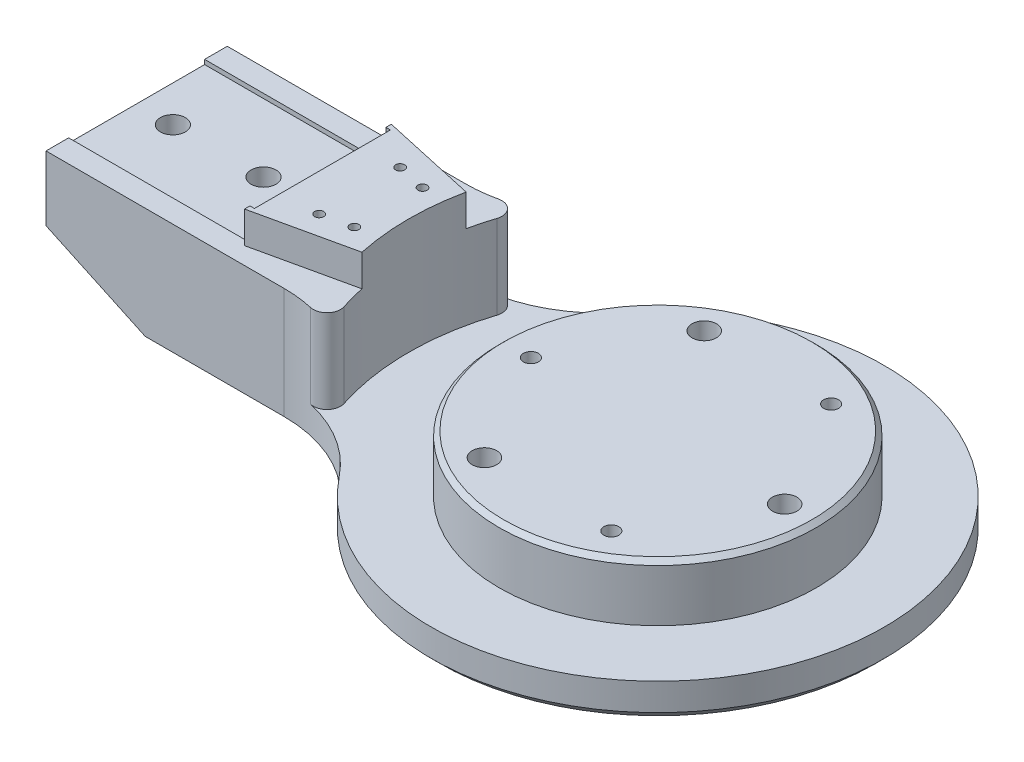
from build123d import *

# Parameters (mm, degrees)
SKETCH1_R           = 35.00000000000001
BOSS_EXTRUDE1_DEPTH = 1
SKETCH3_R           = 50
BOSS_EXTRUDE3_DEPTH = 8
BOSS_EXTRUDE5_START = -8
BOSS_EXTRUDE5_DEPTH = 8
BOSS_EXTRUDE6_DEPTH = 18.5
FILLET1_R           = 30
CUT_EXTRUDE14_DEPTH = 41
SKETCH26_R          = 2.750000000000008
CUT_EXTRUDE15_DEPTH = 129.1688339652039
CUT_EXTRUDE16_DEPTH = 12
BOSS_EXTRUDE7_DEPTH = 13
CUT_EXTRUDE21_DEPTH = 6
SKETCH34_R          = 0.9999999999999981
SKETCH34_R_2        = 0.9999999999999836
SKETCH34_R_3        = 0.9999999999999983
CUT_EXTRUDE22_DEPTH = 5
CHAMFER4_SIZE       = 1
FILLET3_R           = 3
CHAMFER6_SIZE       = 21.445069205
CHAMFER6_SIZE_2     = 10
CHAMFER7_SIZE       = 2
SKETCH37_W          = 12.834846050171059
SKETCH37_H          = 29.012722943474188
CUT_EXTRUDE24_DEPTH = 15
SKETCH38_R          = 27.891707032209062
CUT_EXTRUDE25_DEPTH = 6
SKETCH39_R          = 35.00000000000001
BOSS_EXTRUDE8_DEPTH = 12.5
CHAMFER8_SIZE       = 1
SKETCH40_R          = 2.700000000000001
CUT_EXTRUDE26_DEPTH = 6.5
CIRPATTERN1_COUNT   = 3
SKETCH41_R          = 1.6499999999999986
CUT_EXTRUDE27_DEPTH = 128.06396040183856
SKETCH42_R          = 2.9999999999999973
CUT_EXTRUDE28_DEPTH = 14
CIRPATTERN2_COUNT   = 3
CHAMFER9_SIZE       = 1


# Some blends are built 0.0001 mm under size
with BuildPart() as part:
    # Sketch1 → Boss-Extrude1 (new body)
    with BuildSketch(Plane(origin=(0, 0, 0), x_dir=(1, 0, 0), z_dir=(0, 1, 0))):
        with Locations(Location((0, 0, 0), (0, 0, 270))):
            Circle(SKETCH1_R)
    extrude(amount=BOSS_EXTRUDE1_DEPTH)

    # Sketch3 → Boss-Extrude3 (add)
    with BuildSketch(Plane.XZ):
        with Locations(Location((0, 0, 0), (0, 0, 270))):
            Circle(SKETCH3_R)
    extrude(amount=BOSS_EXTRUDE3_DEPTH)

    # Sketch22 → Boss-Extrude5 (add)
    with BuildSketch(Plane.XZ.offset(8).offset(BOSS_EXTRUDE5_START)):
        with BuildLine():
            Line((-45.82575694955839, 20.000000000000004), (-115.00000000000001, 19.999999999999996))
            Line((-115.00000000000001, 19.999999999999996), (-114.99999999999999, -20.000000000000004))
            Line((-114.99999999999999, -20.000000000000004), (-45.825756949558404, -19.999999999999996))
            ThreePointArc((-45.825756949558404, -19.999999999999996), (-49.99999999999999, 6.12e-15), (-45.82575694955839, 20.000000000000004))
        make_face()
    extrude(amount=BOSS_EXTRUDE5_DEPTH)

    # Sketch24 → Boss-Extrude6 (add)
    with BuildSketch(Plane(origin=(0, 0, 0), x_dir=(1, 0, 0), z_dir=(0, 1, 0))):
        with BuildLine():
            Line((-115, -20), (-51.234753829797995, -20))
            ThreePointArc((-51.234753829797995, -20), (-55.00000000000001, -1.769e-14), (-51.234753829798, 19.999999999999986))
            Line((-51.234753829798, 19.999999999999986), (-115, 20))
            Line((-115, 20), (-115, -20))
        make_face()
    extrude(amount=BOSS_EXTRUDE6_DEPTH)

    # Fillet1
    # the kernel refuses this fillet: 30 mm, written as the material it adds along each edge
    with BuildSketch(Plane(origin=(-45.82575694955841, 41.56055758606396, -19.99999999999998), x_dir=(0.5169843319372891, 0, -0.8559948601080236), z_dir=(0, -1, 0))) as fillet1_piece_1_section:
        with BuildLine():
            CenterArc((17.08538296381171, -29.73977942887639), FILLET1_R, 97.55200448764381, 51.31781254651054)
            Line((-8.594462839428994, -14.230249470757709), (0, 0))
            ThreePointArc((0, 0), (6.571301139927558, -0.4337009518726829), (13.142602279855161, 2.6e-16))
        make_face()
    fillet1_piece_1 = extrude(amount=49.56055758606396, mode=Mode.PRIVATE)
    fillet1_piece_1 = split(fillet1_piece_1, bisect_by=Plane(origin=(-54.99640948275243, 0, -20.321571005076215), z_dir=(0, 1, 0)), keep=Keep.TOP, mode=Mode.PRIVATE)
    fillet1_piece_1 = fillet1_piece_1 - Plane(origin=(-9.592e-14, 9.249999999999998, -8.9e-16), x_dir=(-0.9315409787235996, 0, 0.36363636363636426), z_dir=(0, -1, 0)) * Cylinder(54.999999999999915, 157, mode=Mode.PRIVATE)
    fillet1_piece_1 = split(fillet1_piece_1, bisect_by=Plane(origin=(-54.99640948275243, 18.5, -20.321571005076215), z_dir=(0, -1, 0)), keep=Keep.TOP, mode=Mode.PRIVATE)
    add(fillet1_piece_1)
    with BuildSketch(Plane(origin=(-45.825756949558404, 0, -20), x_dir=(0.5169843319372893, 0, -0.8559948601080234), z_dir=(0, -1, 0))) as fillet1_piece_2_section:
        with BuildLine():
            CenterArc((17.08538296381168, -29.739779428876385), FILLET1_R, 97.5520044876438, 51.31781254651055)
            Line((-8.594462839429019, -14.2302494707577), (0, 0))
            ThreePointArc((0, 0), (6.571301139927535, -0.4337009518726803), (13.142602279855138, 7.9e-16))
        make_face()
    fillet1_piece_2 = extrude(amount=8, mode=Mode.PRIVATE)
    fillet1_piece_2 = fillet1_piece_2 & Plane(origin=(-9.592e-14, -4, -8.9e-16), x_dir=(-0.9315409787235996, 0, 0.36363636363636426), z_dir=(0, -1, 0)) * Cylinder(54.999999999999915, 73, mode=Mode.PRIVATE)
    add(fillet1_piece_2)
    with BuildSketch(Plane(origin=(-45.825756949558404, 0, -20), x_dir=(0.5169843319372893, 0, -0.8559948601080234), z_dir=(0, -1, 0))) as fillet1_piece_3_section:
        with BuildLine():
            CenterArc((17.08538296381168, -29.739779428876385), FILLET1_R, 97.5520044876438, 51.31781254651055)
            Line((-8.594462839429019, -14.2302494707577), (0, 0))
            ThreePointArc((0, 0), (6.571301139927535, -0.4337009518726803), (13.142602279855138, 7.9e-16))
        make_face()
    fillet1_piece_3 = extrude(amount=8, mode=Mode.PRIVATE)
    fillet1_piece_3 = fillet1_piece_3 - Plane(origin=(-9.592e-14, -4, -8.9e-16), x_dir=(-0.9315409787235996, 0, 0.36363636363636426), z_dir=(0, -1, 0)) * Cylinder(54.999999999999915, 73, mode=Mode.PRIVATE)
    add(fillet1_piece_3)
    with BuildSketch(Plane(origin=(-45.82575694955839, 41.56055758606398, 20.000000000000007), x_dir=(0.5169843319372891, 0, 0.8559948601080235), z_dir=(0, -1, 0))) as fillet1_piece_4_section:
        with BuildLine():
            CenterArc((17.085382963811668, 29.739779428876385), FILLET1_R, 211.13018296584565, 51.31781254651054)
            Line((-8.594462839429031, 14.2302494707577), (0, 0))
            ThreePointArc((0, 0), (6.571301139927557, 0.4337009518726914), (13.142602279855119, 9.1e-16))
        make_face()
    fillet1_piece_4 = extrude(amount=49.56055758606398, mode=Mode.PRIVATE)
    fillet1_piece_4 = split(fillet1_piece_4, bisect_by=Plane(origin=(-54.99640948275241, 0, 20.321571005076237), z_dir=(0, 1, 0)), keep=Keep.TOP, mode=Mode.PRIVATE)
    fillet1_piece_4 = split(fillet1_piece_4, bisect_by=Plane(origin=(-54.99640948275241, 18.5, 20.321571005076237), z_dir=(0, -1, 0)), keep=Keep.TOP, mode=Mode.PRIVATE)
    fillet1_piece_4 = fillet1_piece_4 - Plane(origin=(-9.592e-14, 9.249999999999996, -8.9e-16), x_dir=(-0.9315409787235996, 0, 0.36363636363636426), z_dir=(0, -1, 0)) * Cylinder(54.999999999999915, 157, mode=Mode.PRIVATE)
    add(fillet1_piece_4)
    with BuildSketch(Plane(origin=(-45.82575694955839, 0, 20.000000000000007), x_dir=(0.5169843319372891, 0, 0.8559948601080235), z_dir=(0, -1, 0))) as fillet1_piece_5_section:
        with BuildLine():
            CenterArc((17.085382963811668, 29.739779428876385), FILLET1_R, 211.13018296584565, 51.31781254651054)
            Line((-8.594462839429031, 14.2302494707577), (0, 0))
            ThreePointArc((0, 0), (6.571301139927557, 0.4337009518726914), (13.142602279855119, 9.1e-16))
        make_face()
    fillet1_piece_5 = extrude(amount=8, mode=Mode.PRIVATE)
    fillet1_piece_5 = fillet1_piece_5 & Plane(origin=(-9.592e-14, -4.000000000000001, -8.9e-16), x_dir=(-0.9315409787235996, 0, 0.36363636363636426), z_dir=(0, -1, 0)) * Cylinder(54.999999999999915, 73, mode=Mode.PRIVATE)
    add(fillet1_piece_5)
    with BuildSketch(Plane(origin=(-45.82575694955839, 0, 20.000000000000007), x_dir=(0.5169843319372891, 0, 0.8559948601080235), z_dir=(0, -1, 0))) as fillet1_piece_6_section:
        with BuildLine():
            CenterArc((17.085382963811668, 29.739779428876385), FILLET1_R, 211.13018296584565, 51.31781254651054)
            Line((-8.594462839429031, 14.2302494707577), (0, 0))
            ThreePointArc((0, 0), (6.571301139927557, 0.4337009518726914), (13.142602279855119, 9.1e-16))
        make_face()
    fillet1_piece_6 = extrude(amount=8, mode=Mode.PRIVATE)
    fillet1_piece_6 = fillet1_piece_6 - Plane(origin=(-9.592e-14, -3.9999999999999996, -8.9e-16), x_dir=(-0.9315409787235996, 0, 0.36363636363636426), z_dir=(0, -1, 0)) * Cylinder(54.999999999999915, 73, mode=Mode.PRIVATE)
    add(fillet1_piece_6)

    # Sketch25 → Cut-Extrude14 (cut)
    with BuildSketch(Plane.ZY.offset(115)):
        Polygon((-14.999999999999982, 19.5), (15.000000000000018, 19.5), (15.000000000000016, 17.499999999999996), (-14.999999999999982, 17.499999999999996), align=None)
    extrude(amount=-CUT_EXTRUDE14_DEPTH, mode=Mode.SUBTRACT)

    # Sketch26 → Cut-Extrude15 (cut, through all)
    with BuildSketch(Plane.XZ.offset(8)):
        with Locations(Location((-107.00000000000001, 0, 0), (0, 0, 270))):
            Circle(SKETCH26_R)
        with Locations(Location((-87.00000000000001, 0, 0), (0, 0, 270))):
            Circle(SKETCH26_R)
    extrude(amount=-CUT_EXTRUDE15_DEPTH, mode=Mode.SUBTRACT)

    # Sketch27 → Cut-Extrude16 (cut)
    with BuildSketch(Plane.XZ.offset(8)):
        Polygon((-82.28054640148135, -0.37428740930267296), (-84.31613079596788, 3.900023003647695), (-89.03558439448656, 4.274310412950378), (-91.71945359851865, 0.37428740930269205), (-89.6838692040321, -3.900023003647699), (-84.96441560551347, -4.27431041295038), align=None)
        Polygon((-102.2805464014813, -0.3742874093023039), (-104.31613079596819, 3.9000230036479127), (-109.03558439448689, 4.2743104129502205), (-111.71945359851868, 0.3742874093023178), (-109.6838692040318, -3.9000230036479184), (-104.96441560551311, -4.274310412950226), align=None)
    extrude(amount=-CUT_EXTRUDE16_DEPTH, mode=Mode.SUBTRACT)

    # Sketch31 → Boss-Extrude7 (add)
    with BuildSketch(Plane(origin=(0, 18.5, 0), x_dir=(1, 0, 0), z_dir=(0, 1, 0))):
        with BuildLine():
            ThreePointArc((-53.78491816400905, -11.497068238940331), (-55.00000000000001, 1.78e-15), (-53.78491816400905, 11.497068238940333))
            Line((-53.784918164009056, 11.49706823894033), (-75.00000000000001, 16.200338649512723))
            Line((-75.00000000000001, 16.200338649512723), (-75.00000000000001, 15.000000000000064))
            Line((-75.00000000000001, 15.000000000000062), (-74.00000000000001, 15.000000000000062))
            Line((-74.00000000000001, 15.000000000000062), (-74.00000000000001, -14.999999999999938))
            Line((-74.00000000000001, -14.99999999999994), (-75.00000000000001, -14.99999999999994))
            Line((-75.00000000000001, -14.99999999999994), (-75.00000000000001, -16.20033864951273))
            Line((-75.00000000000001, -16.20033864951273), (-53.78491816400905, -11.497068238940331))
        make_face()
    extrude(amount=BOSS_EXTRUDE7_DEPTH)

    # Sketch33 → Cut-Extrude21 (cut)
    with BuildSketch(Plane(origin=(0, 31.5, 0), x_dir=(1, 0, 0), z_dir=(0, 1, 0))):
        Polygon((-55.01517410235079, -11.769809414155478), (-67.9999109970459, -14.648456279532263), (-70.10648365162008, -5.146321092962614), (-75.00000000000001, -5.146321092962625), (-75.00000000000001, 5.14632109296261), (-70.10648365162008, 5.146321092962607), (-67.9999109970459, 14.648456279532258), (-55.0151741023508, 11.769809414155473), (-57.019051941153975, 2.730900606366049), (-57.019051941153975, -2.730900606366056), align=None)
    extrude(amount=-CUT_EXTRUDE21_DEPTH, mode=Mode.SUBTRACT)

    # Sketch34 → Cut-Extrude22 (cut)
    with BuildSketch(Plane(origin=(0, 25.500000000000004, 0), x_dir=(1, 0, 0), z_dir=(0, 1, 0))):
        with Locations(Location((-59.4384225576429, -7.526594465233379, 0), (0, 0, 90))):
            Circle(SKETCH34_R)
        with Locations(Location((-65.78434660392244, -8.93345195583105, 0), (0, 0, 90))):
            Circle(SKETCH34_R_2)
        with Locations(Location((-65.78434660392244, 8.933451955831046, 0), (0, 0, 270))):
            Circle(SKETCH34_R_3)
        with Locations(Location((-59.4384225576429, 7.526594465233379, 0), (0, 0, 270))):
            Circle(SKETCH34_R_3)
    extrude(amount=-CUT_EXTRUDE22_DEPTH, mode=Mode.SUBTRACT)

    # Chamfer4
    chamfer4_edges = [part.edges().sort_by_distance(p)[0] for p in [
        (1.072e-14, 1, -35.00000000000001),
    ]]
    chamfer(chamfer4_edges, length=CHAMFER4_SIZE - 0.0001)  # a hair under: the kernel refuses the full size

    # Fillet3
    fillet3_edges = [part.edges().sort_by_distance(p)[0] for p in [
        (-50.11900944881917, 9.25, -22.651377262082175),
        (-50.11900944881917, 9.25, 22.651377262082175),
    ]]
    fillet(fillet3_edges, radius=FILLET3_R)

    # Chamfer6
    # the kernel refuses this chamfer: 21.445069205, 10 mm, written as the material it takes off along each edge
    with BuildSketch(Plane(origin=(-115.00000000000006, -8, 75.56364829338291), x_dir=(0.9998669641130703, -0.01631116413111022, 0), z_dir=(7.1e-16, 0, -1))) as chamfer6_piece_1:
        Polygon((CHAMFER6_SIZE * 0.999866964118, -CHAMFER6_SIZE * 0.0163111641312), (-CHAMFER6_SIZE_2 * 0.0163111641311, -CHAMFER6_SIZE_2 * 0.999866964113), (0, 0), align=None)
    extrude(amount=151.12729658676582, mode=Mode.SUBTRACT)

    # Chamfer7
    chamfer7_edges = [part.edges().sort_by_distance(p)[0] for p in [
        (-78.00245538943895, -8, -20),
        (-104.27746539744713, -2.9999999999993117, -20.000000000000014),
        (-104.27746539744714, -2.999999999999309, 19.99999999999999),
        (50.00000000000001, -8, -1.2434e-13),
        (-78.00245538943881, -8, 20),
        (-49.459598927217584, -8, -22.958365434019104),
        (-49.45959892721735, -8, 22.958365434019218),
    ]]
    chamfer(chamfer7_edges, length=CHAMFER7_SIZE)

    # Sketch37 → Cut-Extrude24 (cut)
    with BuildSketch(Plane(origin=(0, 25.500000000000004, 0), x_dir=(1, 0, 0), z_dir=(0, 1, 0))):
        with Locations((-55, 2.66e-15)):
            Rectangle(SKETCH37_W, SKETCH37_H)
    extrude(amount=CUT_EXTRUDE24_DEPTH, mode=Mode.SUBTRACT)

    # Sketch38 → Cut-Extrude25 (cut)
    with BuildSketch(Plane(origin=(0, 25.500000000000004, 0), x_dir=(1, 0, 0), z_dir=(0, 1, 0))):
        with Locations((-75.67479968793842, -4.698694832568158)):
            Circle(SKETCH38_R)
    extrude(amount=CUT_EXTRUDE25_DEPTH, mode=Mode.SUBTRACT)

    # Sketch39 → Boss-Extrude8 (add)
    with BuildSketch(Plane(origin=(0, 0, 0), x_dir=(1, 0, 0), z_dir=(0, 1, 0))):
        with Locations(Location((0, 0, 0), (0, 0, 270))):
            Circle(SKETCH39_R)
    extrude(amount=BOSS_EXTRUDE8_DEPTH)

    # Chamfer8
    chamfer8_edges = [part.edges().sort_by_distance(p)[0] for p in [
        (1.072e-14, 12.5, -35.00000000000001),
    ]]
    chamfer(chamfer8_edges, length=CHAMFER8_SIZE)

    # Sketch40 → Cut-Extrude26 (cut)
    with BuildSketch(Plane(origin=(0, 12.5, 0), x_dir=(1, 0, 0), z_dir=(0, 1, 0))):
        with Locations(Location((-13.999999999999947, 24.248711305964314, 0), (0, 0, 270))):
            Circle(SKETCH40_R)
    cut_extrude26 = extrude(amount=-CUT_EXTRUDE26_DEPTH, mode=Mode.SUBTRACT)

    # CirPattern1: Cut-Extrude26 ×3 about axis
    cirpattern1_axis = Axis((-1.23e-15, 0, 1.87e-15), (0, 1, 0))
    for i in range(1, CIRPATTERN1_COUNT):
        add(cut_extrude26.rotate(cirpattern1_axis, i * 360 / CIRPATTERN1_COUNT), mode=Mode.SUBTRACT)

    # Sketch41 → Cut-Extrude27 (cut, through all)
    with BuildSketch(Plane(origin=(0, 12.5, 0), x_dir=(1, 0, 0), z_dir=(0, 1, 0))):
        with Locations(Location((-28, -2.0238e-13, 0), (0, 0, 270))):
            Circle(SKETCH41_R)
    cut_extrude27 = extrude(amount=-CUT_EXTRUDE27_DEPTH, mode=Mode.SUBTRACT)

    # Sketch42 → Cut-Extrude28 (cut)
    with BuildSketch(Plane.XZ.offset(8)):
        with Locations(Location((-28, 2.0123e-13, 0), (0, 0, 270))):
            Circle(SKETCH42_R)
    cut_extrude28 = extrude(amount=-CUT_EXTRUDE28_DEPTH, mode=Mode.SUBTRACT)

    # CirPattern2: Cut-Extrude27, Cut-Extrude28 ×3 about axis
    cirpattern2_axis = Axis((1.44e-15, 0, 1.48e-15), (0, 1, 0))
    add([cut_extrude27.rotate(cirpattern2_axis, i * 360 / CIRPATTERN2_COUNT) for i in range(1, CIRPATTERN2_COUNT)], mode=Mode.SUBTRACT)
    add([cut_extrude28.rotate(cirpattern2_axis, i * 360 / CIRPATTERN2_COUNT) for i in range(1, CIRPATTERN2_COUNT)], mode=Mode.SUBTRACT)

    # Chamfer9
    chamfer9_edges = [part.edges().sort_by_distance(p)[0] for p in [
        (-28, 6, -1.6499999999997963),
        (12.571058083755846, 6, 25.07371130596419),
        (15.428941916244161, 6, -23.423711305964375),
    ]]
    chamfer(chamfer9_edges, length=CHAMFER9_SIZE)


solid = part.part
